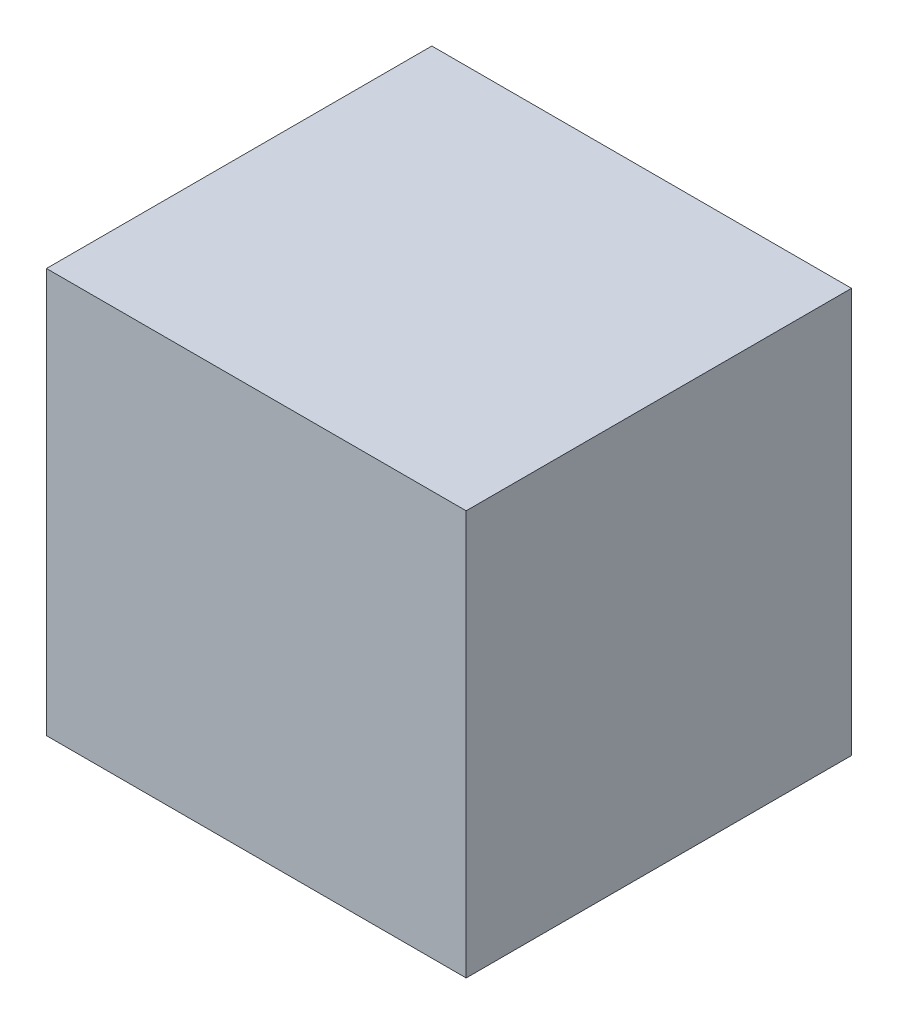
from build123d import *

# Parameters (mm, degrees)
ESTRUSIONE_ESTRUSIONE1_DEPTH      = 78
ESTRUSIONE_ESTRUSIONE1_DEPTH_BACK = 78
SCHIZZO1_W                        = 169.9
SCHIZZO1_H                        = 163.8


with BuildPart() as part:
    # Schizzo1 → Estrusione-Estrusione1 (new, two sides: drawn at the far end of the back side and taken through both)
    with BuildSketch(Plane.XY.offset(-ESTRUSIONE_ESTRUSIONE1_DEPTH_BACK)):
        Rectangle(SCHIZZO1_W, SCHIZZO1_H)
    extrude(amount=ESTRUSIONE_ESTRUSIONE1_DEPTH + ESTRUSIONE_ESTRUSIONE1_DEPTH_BACK)


solid = part.part
